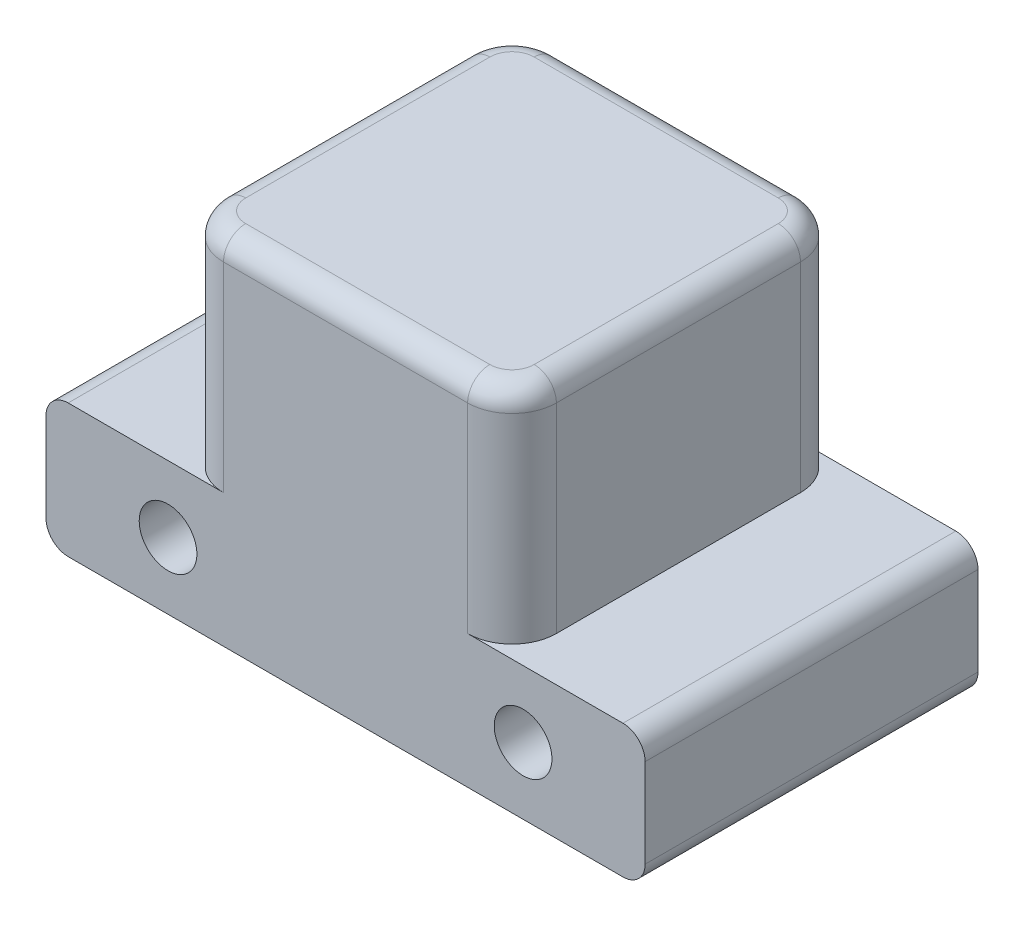
from build123d import *

# Parameters (mm, degrees)
SKETCH_1_R          = 1.3
EXTRUDE_1_DEPTH     = 15
FILLET_1_R          = 2
FILLET_3_R          = 1
FILLET_4_R          = 1
SKETCH_3_R          = 3.15
CUT_EXTRUDE_2_DEPTH = 2.8


with BuildPart() as part:
    # ｽｹｯﾁ1 → ﾎﾞｽ - 押し出し1 (new body)
    with BuildSketch(Plane.XY):
        Polygon((-7.5, 8), (7.5, 8), (7.5, -2), (13.5, -2), (13.5, -8), (7.5, -8), (-7.5, -8), (-13.5, -8), (-13.5, -2), (-7.5, -2), align=None)
        with Locations((8, -5)):
            Circle(SKETCH_1_R, mode=Mode.SUBTRACT)
        with Locations((-8, -5)):
            Circle(SKETCH_1_R, mode=Mode.SUBTRACT)
    extrude(amount=EXTRUDE_1_DEPTH)

    # ﾌｨﾚｯﾄ1
    fillet_1_edges = [part.edges().sort_by_distance(p)[0] for p in [
        (-7.5, 3, 0),
        (7.5, 3, 0),
        (7.5, 3, 15),
        (-7.5, 3, 15),
    ]]
    fillet(fillet_1_edges, radius=FILLET_1_R)

    # ﾌｨﾚｯﾄ3
    fillet_3_edges = [part.edges().sort_by_distance(p)[0] for p in [
        (13.5, -8, 7.5),
        (13.5, -2, 7.5),
        (-13.5, -8, 7.5),
        (-13.5, -2, 7.5),
    ]]
    fillet(fillet_3_edges, radius=FILLET_3_R)

    # ﾌｨﾚｯﾄ4
    fillet_4_edges = [part.edges().sort_by_distance(p)[0] for p in [
        (6.914213562, 8, 14.414213562),
        (7.5, 8, 7.5),
        (6.914213562, 8, 0.585786438),
        (0, 8, 0),
        (-6.914213562, 8, 0.585786438),
        (-7.5, 8, 7.5),
        (-6.914213562, 8, 14.414213562),
        (0, 8, 15),
    ]]
    fillet(fillet_4_edges, radius=FILLET_4_R)

    # ｽｹｯﾁ3 → ｶｯﾄ - 押し出し2 (cut)
    with BuildSketch(Plane(origin=(0, 7, 0), x_dir=(1, 0, 0), z_dir=(0, 1, 0))):
        with Locations((0, -7.5)):
            Circle(SKETCH_3_R)
    extrude(amount=-CUT_EXTRUDE_2_DEPTH, mode=Mode.SUBTRACT)


solid = part.part
